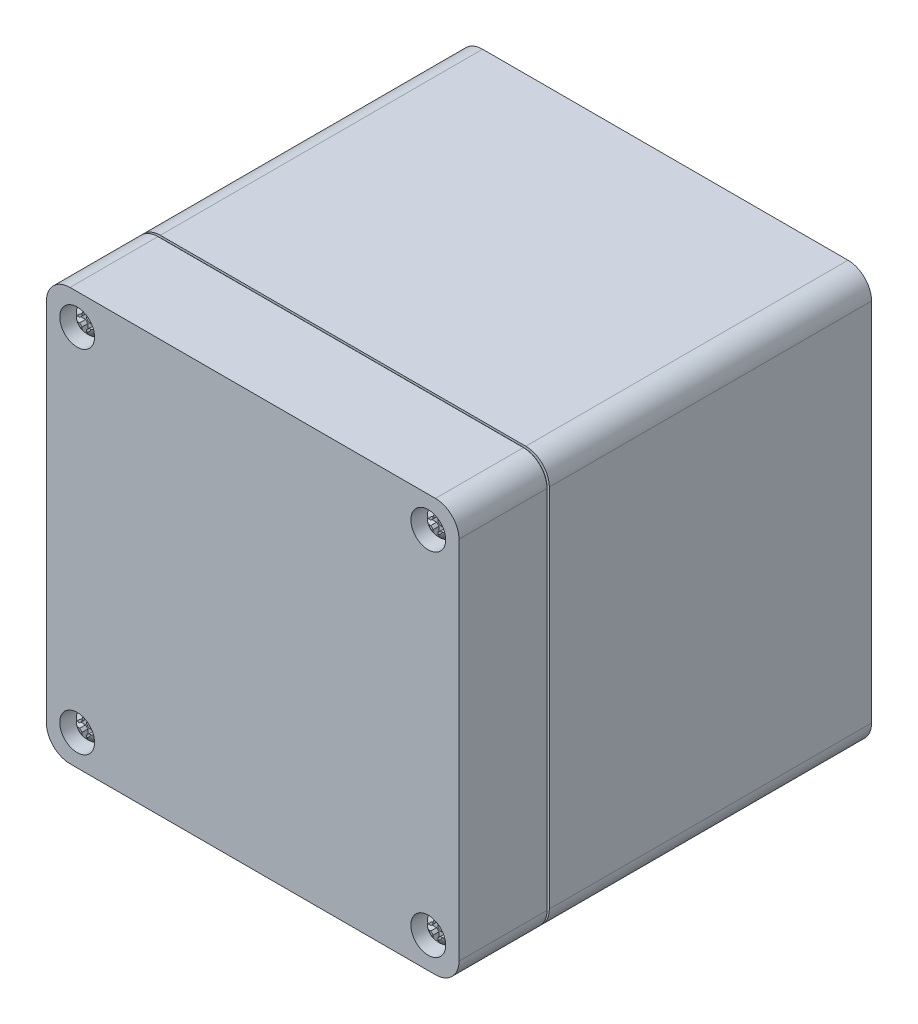
from build123d import *
from OCP.BRepFilletAPI import BRepFilletAPI_MakeChamfer

# Parameters (mm, degrees)
SKETCH3_W                     = 88.9
SKETCH3_H                     = 88.9
BOSS_EXTRUDE1_DEPTH           = 73.8886
CUT_EXTRUDE1_DEPTH            = 70.88886
FILLET1_R                     = 6.35
FILLET2_R                     = 2.54
SKETCH5_W                     = 88.9
SKETCH5_H                     = 88.9
CUT_EXTRUDE2_DEPTH            = 3.45186
SKETCH6_R                     = 2.804922
CUT_EXTRUDE3_DEPTH            = 95.408364787
CUT_EXTRUDE3_DRAFT            = 0.5
CUT_EXTRUDE3_PROFILE_2_DEPTH  = 95.408364787
CUT_EXTRUDE3_PROFILE_2_DRAFT  = 0.5
CUT_EXTRUDE3_PROFILE_3_DEPTH  = 95.408364787
CUT_EXTRUDE3_PROFILE_3_DRAFT  = 0.5
CUT_EXTRUDE3_PROFILE_4_DEPTH  = 95.408364787
CUT_EXTRUDE3_PROFILE_4_DRAFT  = 0.5
SKETCH9_R                     = 4.24942
CUT_EXTRUDE5_DEPTH            = 62.43574
CUT_EXTRUDE5_DRAFT            = -0.5
CUT_EXTRUDE5_PROFILE_2_DEPTH  = 62.43574
CUT_EXTRUDE5_PROFILE_2_DRAFT  = -0.5
CUT_EXTRUDE5_PROFILE_3_DEPTH  = 62.43574
CUT_EXTRUDE5_PROFILE_3_DRAFT  = -0.5
CUT_EXTRUDE5_PROFILE_4_DEPTH  = 62.43574
CUT_EXTRUDE5_PROFILE_4_DRAFT  = -0.5
SKETCH11_R                    = 1.6256
CUT_EXTRUDE6_DEPTH            = 95.408364787
CUT_EXTRUDE7_DEPTH            = 1.27
CHAMFER1_SIZE                 = 0.508
FILLET5_R                     = 1.016
LPATTERN1_COUNT               = 2
LPATTERN1_PITCH               = 75.65644
LPATTERN1_2_COUNT             = 2
LPATTERN1_2_PITCH             = 75.65644
CUT_EXTRUDE8_DEPTH            = 67.437
SKETCH15_R                    = 1.5875
CUT_EXTRUDE9_DEPTH            = 106.190107314
MIRROR2_COPY_1_DEPTH          = 67.437
MIRROR2_COPY_2_SKETCH_R       = 1.5875
MIRROR2_COPY_2_DEPTH          = 106.190107314
SKETCH16_W                    = 88.9
SKETCH16_H                    = 88.9
SKETCH16_W_2                  = 87.95004
SKETCH16_H_2                  = 87.95004
CUT_EXTRUDE11_DEPTH           = 1.00076
FILLET3_R                     = 5.08
BOSS_EXTRUDE2_DEPTH           = 19.46402
CUT_EXTRUDE12_DEPTH           = 98.010979842
CUT_EXTRUDE12_DEPTH_BACK      = 98.010979842
SKETCH18_R                    = 1.75006
SKETCH19_R                    = 3.75031
CUT_EXTRUDE13_DEPTH           = 4.74726
SKETCH20_R                    = 3.24739
CUT_EXTRUDE14_DEPTH           = 13.70076
CUT_EXTRUDE14_DRAFT           = -1
CUT_EXTRUDE14_PROFILE_2_DEPTH = 13.70076
CUT_EXTRUDE14_PROFILE_2_DRAFT = -1
CUT_EXTRUDE14_PROFILE_3_DEPTH = 13.70076
CUT_EXTRUDE14_PROFILE_3_DRAFT = -1
CUT_EXTRUDE14_PROFILE_4_DEPTH = 13.70076
CUT_EXTRUDE14_PROFILE_4_DRAFT = -1
CUT_EXTRUDE15_DEPTH           = 16.46428
CUT_EXTRUDE17_DEPTH           = 0.508
CUT_EXTRUDE18_DEPTH           = 15.95628
FILLET4_R                     = 0.508
CHAMFER2_SIZE                 = 3.048
CHAMFER2_SIZE2                = 0.106438505
CHAMFER3_SIZE                 = 3.048
CHAMFER3_SIZE2                = 0.106438505
SKETCH44_R                    = 7
CUT_EXTRUDE24_DEPTH           = 2.99974
SKETCH45_R                    = 2.25
CUT_EXTRUDE26_DEPTH           = 2.99974
CHAMFER4_SIZE                 = 2.3


with BuildPart() as part:
    # Sketch3 → Boss-Extrude1 (new body)
    with BuildSketch(Plane.XY):
        Rectangle(SKETCH3_W, SKETCH3_H)
    extrude(amount=-BOSS_EXTRUDE1_DEPTH)

    # Sketch4 → Cut-Extrude1 (cut)
    with BuildSketch(Plane.XY):
        Polygon((-41.45026, 21.95068), (-31.75, 21.95068), (-31.75, 41.45026), (31.75, 41.45026), (31.75, 21.95068), (41.45026, 21.95068), (41.45026, -21.95068), (31.75, -21.95068), (31.75, -41.45026), (-31.75, -41.45026), (-31.75, -21.95068), (-41.45026, -21.95068), align=None)
    extrude(amount=-CUT_EXTRUDE1_DEPTH, mode=Mode.SUBTRACT)

    # Fillet1
    fillet1_edges = [part.edges().sort_by_distance(p)[0] for p in [
        (-31.75, 21.95068, -35.44443),
        (31.75, 21.95068, -35.44443),
        (31.75, -21.95068, -35.44443),
        (-31.75, -21.95068, -35.44443),
    ]]
    fillet(fillet1_edges, radius=FILLET1_R)

    # Fillet2
    fillet2_edges = [part.edges().sort_by_distance(p)[0] for p in [
        (-41.45026, -21.95068, -35.44443),
        (-41.45026, 21.95068, -35.44443),
        (-31.75, 41.45026, -35.44443),
        (31.75, 41.45026, -35.44443),
        (41.45026, 21.95068, -35.44443),
        (41.45026, -21.95068, -35.44443),
        (31.75, -41.45026, -35.44443),
        (-31.75, -41.45026, -35.44443),
        (-41.45026, 0, -70.88886),
        (-39.77513, 21.95068, -70.88886),
        (0, 41.45026, -70.88886),
        (31.75, 34.87547, -70.88886),
        (41.45026, 0, -70.88886),
        (39.77513, -21.95068, -70.88886),
        (0, -41.45026, -70.88886),
        (-31.75, -34.87547, -70.88886),
        (39.77513, 21.95068, -70.88886),
        (31.75, -34.87547, -70.88886),
        (-39.77513, -21.95068, -70.88886),
        (-31.75, 34.87547, -70.88886),
        (33.609871939, 23.810551939, -70.88886),
        (33.609871939, -23.810551939, -70.88886),
        (-33.609871939, -23.810551939, -70.88886),
        (-33.609871939, 23.810551939, -70.88886),
    ]]
    fillet(fillet2_edges, radius=FILLET2_R)

    # Sketch5 → Cut-Extrude2 (cut)
    with BuildSketch(Plane.XY):
        Rectangle(SKETCH5_W, SKETCH5_H)
        with BuildLine():
            Line((33.24987, 28.30068), (33.24987, 38.91026))
            ThreePointArc((33.24987, 38.91026), (32.066619472, 41.766879472), (29.21, 42.95013))
            Line((29.21, 42.95013), (-29.21, 42.95013))
            ThreePointArc((-29.21, 42.95013), (-32.066619472, 41.766879472), (-33.24987, 38.91026))
            Line((-33.24987, 38.91026), (-33.24987, 28.30068))
            ThreePointArc((-33.24987, 28.30068), (-34.670440187, 24.871120187), (-38.1, 23.45055))
            Line((-38.1, 23.45055), (-38.91026, 23.45055))
            ThreePointArc((-38.91026, 23.45055), (-41.766879472, 22.267299472), (-42.95013, 19.41068))
            Line((-42.95013, 19.41068), (-42.95013, -19.41068))
            ThreePointArc((-42.95013, -19.41068), (-41.766879472, -22.267299472), (-38.91026, -23.45055))
            Line((-38.91026, -23.45055), (-38.1, -23.45055))
            ThreePointArc((-38.1, -23.45055), (-34.670440187, -24.871120187), (-33.24987, -28.30068))
            Line((-33.24987, -28.30068), (-33.24987, -38.91026))
            ThreePointArc((-33.24987, -38.91026), (-32.066619472, -41.766879472), (-29.21, -42.95013))
            Line((-29.21, -42.95013), (29.21, -42.95013))
            ThreePointArc((29.21, -42.95013), (32.066619472, -41.766879472), (33.24987, -38.91026))
            Line((33.24987, -38.91026), (33.24987, -28.30068))
            ThreePointArc((33.24987, -28.30068), (34.670440187, -24.871120187), (38.1, -23.45055))
            Line((38.1, -23.45055), (38.91026, -23.45055))
            ThreePointArc((38.91026, -23.45055), (41.766879472, -22.267299472), (42.95013, -19.41068))
            Line((42.95013, -19.41068), (42.95013, 19.41068))
            ThreePointArc((42.95013, 19.41068), (41.766879472, 22.267299472), (38.91026, 23.45055))
            Line((38.91026, 23.45055), (38.1, 23.45055))
            ThreePointArc((38.1, 23.45055), (34.670440187, 24.871120187), (33.24987, 28.30068))
        make_face(mode=Mode.SUBTRACT)
    extrude(amount=-CUT_EXTRUDE2_DEPTH, mode=Mode.SUBTRACT)


with BuildPart() as cut_extrude3_tool:
    # Sketch6 → Cut-Extrude3 (with draft: the straight prism first)
    with BuildSketch(Plane.XY.offset(-3.45186)):
        with Locations((37.82822, 37.82822)):
            Circle(SKETCH6_R)
    extrude(amount=-CUT_EXTRUDE3_DEPTH)
    # Cut-Extrude3: the draft: its side faces are tilted about the plane it starts from
    cut_extrude3_sides = [cut_extrude3_tool.faces().sort_by_distance(p)[0] for p in [
        (35.023298, 37.82822, -51.156042394),
    ]]
    draft(cut_extrude3_sides, Plane.XY.offset(-3.45186), CUT_EXTRUDE3_DRAFT)


with BuildPart() as part_1:
    add(part.part)

    # Cut-Extrude3: cut by cut_extrude3_tool
    add(cut_extrude3_tool.part, mode=Mode.SUBTRACT)


with BuildPart() as cut_extrude3_profile_2_tool:
    # Sketch6 → Cut-Extrude3 profile 2 (with draft: the straight prism first)
    with BuildSketch(Plane.XY.offset(-3.45186)):
        with Locations((-37.82822, 37.82822)):
            Circle(SKETCH6_R)
    extrude(amount=-CUT_EXTRUDE3_PROFILE_2_DEPTH)
    # Cut-Extrude3 profile 2: the draft: its side faces are tilted about the plane it starts from
    cut_extrude3_profile_2_sides = [cut_extrude3_profile_2_tool.faces().sort_by_distance(p)[0] for p in [
        (-40.633142, 37.82822, -51.156042394),
    ]]
    draft(cut_extrude3_profile_2_sides, Plane.XY.offset(-3.45186), CUT_EXTRUDE3_PROFILE_2_DRAFT)


with BuildPart() as part_2:
    add(part_1.part)

    # Cut-Extrude3 profile 2: cut by cut_extrude3_profile_2_tool
    add(cut_extrude3_profile_2_tool.part, mode=Mode.SUBTRACT)


with BuildPart() as cut_extrude3_profile_3_tool:
    # Sketch6 → Cut-Extrude3 profile 3 (with draft: the straight prism first)
    with BuildSketch(Plane.XY.offset(-3.45186)):
        with Locations((-37.82822, -37.82822)):
            Circle(SKETCH6_R)
    extrude(amount=-CUT_EXTRUDE3_PROFILE_3_DEPTH)
    # Cut-Extrude3 profile 3: the draft: its side faces are tilted about the plane it starts from
    cut_extrude3_profile_3_sides = [cut_extrude3_profile_3_tool.faces().sort_by_distance(p)[0] for p in [
        (-40.633142, -37.82822, -51.156042394),
    ]]
    draft(cut_extrude3_profile_3_sides, Plane.XY.offset(-3.45186), CUT_EXTRUDE3_PROFILE_3_DRAFT)


with BuildPart() as part_3:
    add(part_2.part)

    # Cut-Extrude3 profile 3: cut by cut_extrude3_profile_3_tool
    add(cut_extrude3_profile_3_tool.part, mode=Mode.SUBTRACT)


with BuildPart() as cut_extrude3_profile_4_tool:
    # Sketch6 → Cut-Extrude3 profile 4 (with draft: the straight prism first)
    with BuildSketch(Plane.XY.offset(-3.45186)):
        with Locations((37.82822, -37.82822)):
            Circle(SKETCH6_R)
    extrude(amount=-CUT_EXTRUDE3_PROFILE_4_DEPTH)
    # Cut-Extrude3 profile 4: the draft: its side faces are tilted about the plane it starts from
    cut_extrude3_profile_4_sides = [cut_extrude3_profile_4_tool.faces().sort_by_distance(p)[0] for p in [
        (35.023298, -37.82822, -51.156042394),
    ]]
    draft(cut_extrude3_profile_4_sides, Plane.XY.offset(-3.45186), CUT_EXTRUDE3_PROFILE_4_DRAFT)


with BuildPart() as part_4:
    add(part_3.part)

    # Cut-Extrude3 profile 4: cut by cut_extrude3_profile_4_tool
    add(cut_extrude3_profile_4_tool.part, mode=Mode.SUBTRACT)


with BuildPart() as cut_extrude5_tool:
    # Sketch9 → Cut-Extrude5 (with draft: the straight prism first)
    with BuildSketch(Plane(origin=(0, 0, -73.8886), x_dir=(-1, 0, 0), z_dir=(0, 0, -1))):
        with Locations((-37.82822, 37.82822)):
            Circle(SKETCH9_R)
    extrude(amount=-CUT_EXTRUDE5_DEPTH)
    # Cut-Extrude5: the draft: its side faces are tilted about the plane it starts from
    cut_extrude5_sides = [cut_extrude5_tool.faces().sort_by_distance(p)[0] for p in [
        (42.07764, 37.82822, -42.67073),
    ]]
    draft(cut_extrude5_sides, Plane(origin=(0, 0, -73.8886), x_dir=(-1, 0, 0), z_dir=(0, 0, -1)), CUT_EXTRUDE5_DRAFT)


with BuildPart() as part_5:
    add(part_4.part)

    # Cut-Extrude5: cut by cut_extrude5_tool
    add(cut_extrude5_tool.part, mode=Mode.SUBTRACT)


with BuildPart() as cut_extrude5_profile_2_tool:
    # Sketch9 → Cut-Extrude5 profile 2 (with draft: the straight prism first)
    with BuildSketch(Plane(origin=(0, 0, -73.8886), x_dir=(-1, 0, 0), z_dir=(0, 0, -1))):
        with Locations((37.82822, 37.82822)):
            Circle(SKETCH9_R)
    extrude(amount=-CUT_EXTRUDE5_PROFILE_2_DEPTH)
    # Cut-Extrude5 profile 2: the draft: its side faces are tilted about the plane it starts from
    cut_extrude5_profile_2_sides = [cut_extrude5_profile_2_tool.faces().sort_by_distance(p)[0] for p in [
        (-33.5788, 37.82822, -42.67073),
    ]]
    draft(cut_extrude5_profile_2_sides, Plane(origin=(0, 0, -73.8886), x_dir=(-1, 0, 0), z_dir=(0, 0, -1)), CUT_EXTRUDE5_PROFILE_2_DRAFT)


with BuildPart() as part_6:
    add(part_5.part)

    # Cut-Extrude5 profile 2: cut by cut_extrude5_profile_2_tool
    add(cut_extrude5_profile_2_tool.part, mode=Mode.SUBTRACT)


with BuildPart() as cut_extrude5_profile_3_tool:
    # Sketch9 → Cut-Extrude5 profile 3 (with draft: the straight prism first)
    with BuildSketch(Plane(origin=(0, 0, -73.8886), x_dir=(-1, 0, 0), z_dir=(0, 0, -1))):
        with Locations((37.82822, -37.82822)):
            Circle(SKETCH9_R)
    extrude(amount=-CUT_EXTRUDE5_PROFILE_3_DEPTH)
    # Cut-Extrude5 profile 3: the draft: its side faces are tilted about the plane it starts from
    cut_extrude5_profile_3_sides = [cut_extrude5_profile_3_tool.faces().sort_by_distance(p)[0] for p in [
        (-33.5788, -37.82822, -42.67073),
    ]]
    draft(cut_extrude5_profile_3_sides, Plane(origin=(0, 0, -73.8886), x_dir=(-1, 0, 0), z_dir=(0, 0, -1)), CUT_EXTRUDE5_PROFILE_3_DRAFT)


with BuildPart() as part_7:
    add(part_6.part)

    # Cut-Extrude5 profile 3: cut by cut_extrude5_profile_3_tool
    add(cut_extrude5_profile_3_tool.part, mode=Mode.SUBTRACT)


with BuildPart() as cut_extrude5_profile_4_tool:
    # Sketch9 → Cut-Extrude5 profile 4 (with draft: the straight prism first)
    with BuildSketch(Plane(origin=(0, 0, -73.8886), x_dir=(-1, 0, 0), z_dir=(0, 0, -1))):
        with Locations((-37.82822, -37.82822)):
            Circle(SKETCH9_R)
    extrude(amount=-CUT_EXTRUDE5_PROFILE_4_DEPTH)
    # Cut-Extrude5 profile 4: the draft: its side faces are tilted about the plane it starts from
    cut_extrude5_profile_4_sides = [cut_extrude5_profile_4_tool.faces().sort_by_distance(p)[0] for p in [
        (42.07764, -37.82822, -42.67073),
    ]]
    draft(cut_extrude5_profile_4_sides, Plane(origin=(0, 0, -73.8886), x_dir=(-1, 0, 0), z_dir=(0, 0, -1)), CUT_EXTRUDE5_PROFILE_4_DRAFT)


with BuildPart() as part_8:
    add(part_7.part)

    # Cut-Extrude5 profile 4: cut by cut_extrude5_profile_4_tool
    add(cut_extrude5_profile_4_tool.part, mode=Mode.SUBTRACT)

    # Sketch14 → Cut-Extrude8 (cut)
    with BuildSketch(Plane.XY.offset(-3.45186)):
        with BuildLine():
            Line((-41.45026, 33.02), (-34.0233, 33.02))
            ThreePointArc((-34.0233, 33.02), (-33.484484633, 32.796815367), (-33.2613, 32.258))
            Line((-33.2613, 32.258), (-33.2613, 29.21))
            ThreePointArc((-33.2613, 29.21), (-34.749197552, 25.617897552), (-38.3413, 24.13))
            Line((-38.3413, 24.13), (-41.45026, 24.13))
            Line((-41.45026, 24.13), (-41.45026, 33.02))
        make_face()
    cut_extrude8 = extrude(amount=-CUT_EXTRUDE8_DEPTH, mode=Mode.SUBTRACT)

    # Sketch15 → Cut-Extrude9 (cut, through all)
    with BuildSketch(Plane.XY.offset(-70.88886)):
        with Locations((-38.1, 28.30068)):
            Circle(SKETCH15_R)
    cut_extrude9 = extrude(amount=-CUT_EXTRUDE9_DEPTH, mode=Mode.SUBTRACT)

    # Mirror1: Cut-Extrude8, Cut-Extrude9 across plane
    add(cut_extrude8.mirror(Plane(origin=(0, 0, 0), x_dir=(0, 0, 1), z_dir=(1, 0, 0))), mode=Mode.SUBTRACT)
    add(cut_extrude9.mirror(Plane(origin=(0, 0, 0), x_dir=(0, 0, 1), z_dir=(1, 0, 0))), mode=Mode.SUBTRACT)

    # Mirror2: Cut-Extrude8, Cut-Extrude9 across plane
    add(cut_extrude8.mirror(Plane.ZX), mode=Mode.SUBTRACT)
    add(cut_extrude9.mirror(Plane.ZX), mode=Mode.SUBTRACT)

    # Mirror2 copy 1 sketch → Mirror2 copy 1 (cut)
    with BuildSketch(Plane(origin=(0, 0, -3.45186), x_dir=(-1, 0, 0), z_dir=(0, 0, 1))):
        with BuildLine():
            Line((-41.45026, 33.02), (-34.0233, 33.02))
            ThreePointArc((-34.0233, 33.02), (-33.484484633, 32.796815367), (-33.2613, 32.258))
            Line((-33.2613, 32.258), (-33.2613, 29.21))
            ThreePointArc((-33.2613, 29.21), (-34.749197552, 25.617897552), (-38.3413, 24.13))
            Line((-38.3413, 24.13), (-41.45026, 24.13))
            Line((-41.45026, 24.13), (-41.45026, 33.02))
        make_face()
    extrude(amount=-MIRROR2_COPY_1_DEPTH, mode=Mode.SUBTRACT)

    # Mirror2 copy 2 sketch → Mirror2 copy 2 (cut, through all)
    with BuildSketch(Plane(origin=(0, 0, -70.88886), x_dir=(-1, 0, 0), z_dir=(0, 0, 1))):
        with Locations((-38.1, 28.30068)):
            Circle(MIRROR2_COPY_2_SKETCH_R)
    extrude(amount=-MIRROR2_COPY_2_DEPTH, mode=Mode.SUBTRACT)

    # Sketch16 → Cut-Extrude11 (cut)
    with BuildSketch(Plane.XY.offset(-3.45186)):
        Rectangle(SKETCH16_W, SKETCH16_H)
        Rectangle(SKETCH16_W_2, SKETCH16_H_2, mode=Mode.SUBTRACT)
    extrude(amount=-CUT_EXTRUDE11_DEPTH, mode=Mode.SUBTRACT)

    # Fillet3
    fillet3_edges = [part_8.edges().sort_by_distance(p)[0] for p in [
        (43.97502, -43.97502, -3.95224),
        (-43.97502, -43.97502, -3.95224),
        (-43.97502, 43.97502, -3.95224),
        (43.97502, 43.97502, -3.95224),
        (-44.45, 44.45, -39.17061),
        (44.45, 44.45, -39.17061),
        (44.45, -44.45, -39.17061),
        (-44.45, -44.45, -39.17061),
    ]]
    fillet(fillet3_edges, radius=FILLET3_R)

    # Chamfer2: one chamfer whose edges measure the first distance from different faces: ONE call of the kernel's chamfer builder (chamfer() names one face for all edges)
    chamfer2_edges_1 = [part_8.edges().sort_by_distance(p)[0] for p in [
        (34.670440187, 24.871120187, 0),
    ]]
    chamfer2_side_1 = [part_8.faces().sort_by_distance(p)[0] for p in [
        (34.670440187, 24.871120187, -1.72593),
    ]]
    chamfer2_edges_2 = [part_8.edges().sort_by_distance(p)[0] for p in [
        (38.50513, 23.45055, 0),
    ]]
    chamfer2_side_2 = [part_8.faces().sort_by_distance(p)[0] for p in [
        (38.50513, 23.45055, -1.72593),
    ]]
    chamfer2_edges_3 = [part_8.edges().sort_by_distance(p)[0] for p in [
        (41.766879472, 22.267299472, 0),
    ]]
    chamfer2_side_3 = [part_8.faces().sort_by_distance(p)[0] for p in [
        (41.766879472, 22.267299472, -1.72593),
    ]]
    chamfer2_edges_4 = [part_8.edges().sort_by_distance(p)[0] for p in [
        (42.95013, 0, 0),
    ]]
    chamfer2_side_4 = [part_8.faces().sort_by_distance(p)[0] for p in [
        (42.95013, 0, -1.72593),
    ]]
    chamfer2_edges_5 = [part_8.edges().sort_by_distance(p)[0] for p in [
        (41.766879472, -22.267299472, 0),
    ]]
    chamfer2_side_5 = [part_8.faces().sort_by_distance(p)[0] for p in [
        (41.766879472, -22.267299472, -1.72593),
    ]]
    chamfer2_edges_6 = [part_8.edges().sort_by_distance(p)[0] for p in [
        (38.50513, -23.45055, 0),
    ]]
    chamfer2_side_6 = [part_8.faces().sort_by_distance(p)[0] for p in [
        (38.50513, -23.45055, -1.72593),
    ]]
    chamfer2_edges_7 = [part_8.edges().sort_by_distance(p)[0] for p in [
        (34.670440187, -24.871120187, 0),
    ]]
    chamfer2_side_7 = [part_8.faces().sort_by_distance(p)[0] for p in [
        (34.670440187, -24.871120187, -1.72593),
    ]]
    chamfer2_edges_8 = [part_8.edges().sort_by_distance(p)[0] for p in [
        (33.24987, -33.60547, 0),
    ]]
    chamfer2_side_8 = [part_8.faces().sort_by_distance(p)[0] for p in [
        (33.24987, -33.60547, -1.72593),
    ]]
    chamfer2_edges_9 = [part_8.edges().sort_by_distance(p)[0] for p in [
        (32.066619472, -41.766879472, 0),
    ]]
    chamfer2_side_9 = [part_8.faces().sort_by_distance(p)[0] for p in [
        (32.066619472, -41.766879472, -1.72593),
    ]]
    chamfer2_edges_10 = [part_8.edges().sort_by_distance(p)[0] for p in [
        (0, -42.95013, 0),
    ]]
    chamfer2_side_10 = [part_8.faces().sort_by_distance(p)[0] for p in [
        (0, -42.95013, -1.72593),
    ]]
    chamfer2_edges_11 = [part_8.edges().sort_by_distance(p)[0] for p in [
        (-32.066619472, -41.766879472, 0),
    ]]
    chamfer2_side_11 = [part_8.faces().sort_by_distance(p)[0] for p in [
        (-32.066619472, -41.766879472, -1.72593),
    ]]
    chamfer2_edges_12 = [part_8.edges().sort_by_distance(p)[0] for p in [
        (-33.24987, -33.60547, 0),
    ]]
    chamfer2_side_12 = [part_8.faces().sort_by_distance(p)[0] for p in [
        (-33.24987, -33.60547, -1.72593),
    ]]
    chamfer2_edges_13 = [part_8.edges().sort_by_distance(p)[0] for p in [
        (-34.670440187, -24.871120187, 0),
    ]]
    chamfer2_side_13 = [part_8.faces().sort_by_distance(p)[0] for p in [
        (-34.670440187, -24.871120187, -1.72593),
    ]]
    chamfer2_edges_14 = [part_8.edges().sort_by_distance(p)[0] for p in [
        (-38.50513, -23.45055, 0),
    ]]
    chamfer2_side_14 = [part_8.faces().sort_by_distance(p)[0] for p in [
        (-38.50513, -23.45055, -1.72593),
    ]]
    chamfer2_edges_15 = [part_8.edges().sort_by_distance(p)[0] for p in [
        (-41.766879472, -22.267299472, 0),
    ]]
    chamfer2_side_15 = [part_8.faces().sort_by_distance(p)[0] for p in [
        (-41.766879472, -22.267299472, -1.72593),
    ]]
    chamfer2_edges_16 = [part_8.edges().sort_by_distance(p)[0] for p in [
        (-42.95013, 0, 0),
    ]]
    chamfer2_side_16 = [part_8.faces().sort_by_distance(p)[0] for p in [
        (-42.95013, 0, -1.72593),
    ]]
    chamfer2_edges_17 = [part_8.edges().sort_by_distance(p)[0] for p in [
        (-41.766879472, 22.267299472, 0),
    ]]
    chamfer2_side_17 = [part_8.faces().sort_by_distance(p)[0] for p in [
        (-41.766879472, 22.267299472, -1.72593),
    ]]
    chamfer2_edges_18 = [part_8.edges().sort_by_distance(p)[0] for p in [
        (-38.50513, 23.45055, 0),
    ]]
    chamfer2_side_18 = [part_8.faces().sort_by_distance(p)[0] for p in [
        (-38.50513, 23.45055, -1.72593),
    ]]
    chamfer2_edges_19 = [part_8.edges().sort_by_distance(p)[0] for p in [
        (-34.670440187, 24.871120187, 0),
    ]]
    chamfer2_side_19 = [part_8.faces().sort_by_distance(p)[0] for p in [
        (-34.670440187, 24.871120187, -1.72593),
    ]]
    chamfer2_edges_20 = [part_8.edges().sort_by_distance(p)[0] for p in [
        (-33.24987, 33.60547, 0),
    ]]
    chamfer2_side_20 = [part_8.faces().sort_by_distance(p)[0] for p in [
        (-33.24987, 33.60547, -1.72593),
    ]]
    chamfer2_edges_21 = [part_8.edges().sort_by_distance(p)[0] for p in [
        (-32.066619472, 41.766879472, 0),
    ]]
    chamfer2_side_21 = [part_8.faces().sort_by_distance(p)[0] for p in [
        (-32.066619472, 41.766879472, -1.72593),
    ]]
    chamfer2_edges_22 = [part_8.edges().sort_by_distance(p)[0] for p in [
        (0, 42.95013, 0),
    ]]
    chamfer2_side_22 = [part_8.faces().sort_by_distance(p)[0] for p in [
        (0, 42.95013, -1.72593),
    ]]
    chamfer2_edges_23 = [part_8.edges().sort_by_distance(p)[0] for p in [
        (32.066619472, 41.766879472, 0),
    ]]
    chamfer2_side_23 = [part_8.faces().sort_by_distance(p)[0] for p in [
        (32.066619472, 41.766879472, -1.72593),
    ]]
    chamfer2_edges_24 = [part_8.edges().sort_by_distance(p)[0] for p in [
        (33.24987, 33.60547, 0),
    ]]
    chamfer2_side_24 = [part_8.faces().sort_by_distance(p)[0] for p in [
        (33.24987, 33.60547, -1.72593),
    ]]
    chamfer2 = BRepFilletAPI_MakeChamfer(part_8.part.solid().wrapped)
    for e in chamfer2_edges_1:
        chamfer2.Add(CHAMFER2_SIZE, CHAMFER2_SIZE2, e.wrapped, chamfer2_side_1[0].wrapped)  # the first distance lies on this face
    for e in chamfer2_edges_2:
        chamfer2.Add(CHAMFER2_SIZE, CHAMFER2_SIZE2, e.wrapped, chamfer2_side_2[0].wrapped)  # the first distance lies on this face
    for e in chamfer2_edges_3:
        chamfer2.Add(CHAMFER2_SIZE, CHAMFER2_SIZE2, e.wrapped, chamfer2_side_3[0].wrapped)  # the first distance lies on this face
    for e in chamfer2_edges_4:
        chamfer2.Add(CHAMFER2_SIZE, CHAMFER2_SIZE2, e.wrapped, chamfer2_side_4[0].wrapped)  # the first distance lies on this face
    for e in chamfer2_edges_5:
        chamfer2.Add(CHAMFER2_SIZE, CHAMFER2_SIZE2, e.wrapped, chamfer2_side_5[0].wrapped)  # the first distance lies on this face
    for e in chamfer2_edges_6:
        chamfer2.Add(CHAMFER2_SIZE, CHAMFER2_SIZE2, e.wrapped, chamfer2_side_6[0].wrapped)  # the first distance lies on this face
    for e in chamfer2_edges_7:
        chamfer2.Add(CHAMFER2_SIZE, CHAMFER2_SIZE2, e.wrapped, chamfer2_side_7[0].wrapped)  # the first distance lies on this face
    for e in chamfer2_edges_8:
        chamfer2.Add(CHAMFER2_SIZE, CHAMFER2_SIZE2, e.wrapped, chamfer2_side_8[0].wrapped)  # the first distance lies on this face
    for e in chamfer2_edges_9:
        chamfer2.Add(CHAMFER2_SIZE, CHAMFER2_SIZE2, e.wrapped, chamfer2_side_9[0].wrapped)  # the first distance lies on this face
    for e in chamfer2_edges_10:
        chamfer2.Add(CHAMFER2_SIZE, CHAMFER2_SIZE2, e.wrapped, chamfer2_side_10[0].wrapped)  # the first distance lies on this face
    for e in chamfer2_edges_11:
        chamfer2.Add(CHAMFER2_SIZE, CHAMFER2_SIZE2, e.wrapped, chamfer2_side_11[0].wrapped)  # the first distance lies on this face
    for e in chamfer2_edges_12:
        chamfer2.Add(CHAMFER2_SIZE, CHAMFER2_SIZE2, e.wrapped, chamfer2_side_12[0].wrapped)  # the first distance lies on this face
    for e in chamfer2_edges_13:
        chamfer2.Add(CHAMFER2_SIZE, CHAMFER2_SIZE2, e.wrapped, chamfer2_side_13[0].wrapped)  # the first distance lies on this face
    for e in chamfer2_edges_14:
        chamfer2.Add(CHAMFER2_SIZE, CHAMFER2_SIZE2, e.wrapped, chamfer2_side_14[0].wrapped)  # the first distance lies on this face
    for e in chamfer2_edges_15:
        chamfer2.Add(CHAMFER2_SIZE, CHAMFER2_SIZE2, e.wrapped, chamfer2_side_15[0].wrapped)  # the first distance lies on this face
    for e in chamfer2_edges_16:
        chamfer2.Add(CHAMFER2_SIZE, CHAMFER2_SIZE2, e.wrapped, chamfer2_side_16[0].wrapped)  # the first distance lies on this face
    for e in chamfer2_edges_17:
        chamfer2.Add(CHAMFER2_SIZE, CHAMFER2_SIZE2, e.wrapped, chamfer2_side_17[0].wrapped)  # the first distance lies on this face
    for e in chamfer2_edges_18:
        chamfer2.Add(CHAMFER2_SIZE, CHAMFER2_SIZE2, e.wrapped, chamfer2_side_18[0].wrapped)  # the first distance lies on this face
    for e in chamfer2_edges_19:
        chamfer2.Add(CHAMFER2_SIZE, CHAMFER2_SIZE2, e.wrapped, chamfer2_side_19[0].wrapped)  # the first distance lies on this face
    for e in chamfer2_edges_20:
        chamfer2.Add(CHAMFER2_SIZE, CHAMFER2_SIZE2, e.wrapped, chamfer2_side_20[0].wrapped)  # the first distance lies on this face
    for e in chamfer2_edges_21:
        chamfer2.Add(CHAMFER2_SIZE, CHAMFER2_SIZE2, e.wrapped, chamfer2_side_21[0].wrapped)  # the first distance lies on this face
    for e in chamfer2_edges_22:
        chamfer2.Add(CHAMFER2_SIZE, CHAMFER2_SIZE2, e.wrapped, chamfer2_side_22[0].wrapped)  # the first distance lies on this face
    for e in chamfer2_edges_23:
        chamfer2.Add(CHAMFER2_SIZE, CHAMFER2_SIZE2, e.wrapped, chamfer2_side_23[0].wrapped)  # the first distance lies on this face
    for e in chamfer2_edges_24:
        chamfer2.Add(CHAMFER2_SIZE, CHAMFER2_SIZE2, e.wrapped, chamfer2_side_24[0].wrapped)  # the first distance lies on this face
    add(Compound.cast(chamfer2.Shape()), mode=Mode.REPLACE)

    # Chamfer3: one chamfer whose edges measure the first distance from different faces: ONE call of the kernel's chamfer builder (chamfer() names one face for all edges)
    chamfer3_edges_1 = [part_8.edges().sort_by_distance(p)[0] for p in [
        (31.006051224, -40.706311224, 0),
    ]]
    chamfer3_side_1 = [part_8.faces().sort_by_distance(p)[0] for p in [
        (31.006051224, -40.706311224, -34.17443),
    ]]
    chamfer3_edges_2 = [part_8.edges().sort_by_distance(p)[0] for p in [
        (-31.006051224, -40.706311224, 0),
    ]]
    chamfer3_side_2 = [part_8.faces().sort_by_distance(p)[0] for p in [
        (-31.006051224, -40.706311224, -34.17443),
    ]]
    chamfer3_edges_3 = [part_8.edges().sort_by_distance(p)[0] for p in [
        (-40.706311224, -21.206731224, 0),
    ]]
    chamfer3_side_3 = [part_8.faces().sort_by_distance(p)[0] for p in [
        (-40.706311224, -21.206731224, -34.17443),
    ]]
    chamfer3_edges_4 = [part_8.edges().sort_by_distance(p)[0] for p in [
        (-40.706311224, 21.206731224, 0),
    ]]
    chamfer3_side_4 = [part_8.faces().sort_by_distance(p)[0] for p in [
        (-40.706311224, 21.206731224, -34.17443),
    ]]
    chamfer3_edges_5 = [part_8.edges().sort_by_distance(p)[0] for p in [
        (-31.006051224, 40.706311224, 0),
    ]]
    chamfer3_side_5 = [part_8.faces().sort_by_distance(p)[0] for p in [
        (-31.006051224, 40.706311224, -34.17443),
    ]]
    chamfer3_edges_6 = [part_8.edges().sort_by_distance(p)[0] for p in [
        (31.006051224, 40.706311224, 0),
    ]]
    chamfer3_side_6 = [part_8.faces().sort_by_distance(p)[0] for p in [
        (31.006051224, 40.706311224, -34.17443),
    ]]
    chamfer3_edges_7 = [part_8.edges().sort_by_distance(p)[0] for p in [
        (40.706311224, 21.206731224, 0),
    ]]
    chamfer3_side_7 = [part_8.faces().sort_by_distance(p)[0] for p in [
        (40.706311224, 21.206731224, -34.17443),
    ]]
    chamfer3_edges_8 = [part_8.edges().sort_by_distance(p)[0] for p in [
        (40.706311224, -21.206731224, 0),
    ]]
    chamfer3_side_8 = [part_8.faces().sort_by_distance(p)[0] for p in [
        (40.706311224, -21.206731224, -34.17443),
    ]]
    chamfer3_edges_9 = [part_8.edges().sort_by_distance(p)[0] for p in [
        (31.75, 33.60547, 0),
    ]]
    chamfer3_side_9 = [part_8.faces().sort_by_distance(p)[0] for p in [
        (31.75, 33.60547, -34.17443),
    ]]
    chamfer3_edges_10 = [part_8.edges().sort_by_distance(p)[0] for p in [
        (-38.50513, 21.95068, 0),
    ]]
    chamfer3_side_10 = [part_8.faces().sort_by_distance(p)[0] for p in [
        (-38.50513, 21.95068, -34.17443),
    ]]
    chamfer3_edges_11 = [part_8.edges().sort_by_distance(p)[0] for p in [
        (38.50513, -21.95068, 0),
    ]]
    chamfer3_side_11 = [part_8.faces().sort_by_distance(p)[0] for p in [
        (38.50513, -21.95068, -34.17443),
    ]]
    chamfer3_edges_12 = [part_8.edges().sort_by_distance(p)[0] for p in [
        (-31.75, -33.60547, 0),
    ]]
    chamfer3_side_12 = [part_8.faces().sort_by_distance(p)[0] for p in [
        (-31.75, -33.60547, -34.17443),
    ]]
    chamfer3_edges_13 = [part_8.edges().sort_by_distance(p)[0] for p in [
        (-33.609871939, 23.810551939, 0),
    ]]
    chamfer3_side_13 = [part_8.faces().sort_by_distance(p)[0] for p in [
        (-33.609871939, 23.810551939, -34.17443),
    ]]
    chamfer3_edges_14 = [part_8.edges().sort_by_distance(p)[0] for p in [
        (-33.609871939, -23.810551939, 0),
    ]]
    chamfer3_side_14 = [part_8.faces().sort_by_distance(p)[0] for p in [
        (-33.609871939, -23.810551939, -34.17443),
    ]]
    chamfer3_edges_15 = [part_8.edges().sort_by_distance(p)[0] for p in [
        (33.609871939, -23.810551939, 0),
    ]]
    chamfer3_side_15 = [part_8.faces().sort_by_distance(p)[0] for p in [
        (33.609871939, -23.810551939, -34.17443),
    ]]
    chamfer3_edges_16 = [part_8.edges().sort_by_distance(p)[0] for p in [
        (33.609871939, 23.810551939, 0),
    ]]
    chamfer3_side_16 = [part_8.faces().sort_by_distance(p)[0] for p in [
        (33.609871939, 23.810551939, -34.17443),
    ]]
    chamfer3_edges_17 = [part_8.edges().sort_by_distance(p)[0] for p in [
        (-31.75, 33.60547, 0),
    ]]
    chamfer3_side_17 = [part_8.faces().sort_by_distance(p)[0] for p in [
        (-31.75, 33.60547, -34.17443),
    ]]
    chamfer3_edges_18 = [part_8.edges().sort_by_distance(p)[0] for p in [
        (0, 41.45026, 0),
    ]]
    chamfer3_side_18 = [part_8.faces().sort_by_distance(p)[0] for p in [
        (0, 41.45026, -34.17443),
    ]]
    chamfer3_edges_19 = [part_8.edges().sort_by_distance(p)[0] for p in [
        (38.50513, 21.95068, 0),
    ]]
    chamfer3_side_19 = [part_8.faces().sort_by_distance(p)[0] for p in [
        (38.50513, 21.95068, -34.17443),
    ]]
    chamfer3_edges_20 = [part_8.edges().sort_by_distance(p)[0] for p in [
        (41.45026, 0, 0),
    ]]
    chamfer3_side_20 = [part_8.faces().sort_by_distance(p)[0] for p in [
        (41.45026, 0, -34.17443),
    ]]
    chamfer3_edges_21 = [part_8.edges().sort_by_distance(p)[0] for p in [
        (31.75, -33.60547, 0),
    ]]
    chamfer3_side_21 = [part_8.faces().sort_by_distance(p)[0] for p in [
        (31.75, -33.60547, -34.17443),
    ]]
    chamfer3_edges_22 = [part_8.edges().sort_by_distance(p)[0] for p in [
        (0, -41.45026, 0),
    ]]
    chamfer3_side_22 = [part_8.faces().sort_by_distance(p)[0] for p in [
        (0, -41.45026, -34.17443),
    ]]
    chamfer3_edges_23 = [part_8.edges().sort_by_distance(p)[0] for p in [
        (-38.50513, -21.95068, 0),
    ]]
    chamfer3_side_23 = [part_8.faces().sort_by_distance(p)[0] for p in [
        (-38.50513, -21.95068, -34.17443),
    ]]
    chamfer3_edges_24 = [part_8.edges().sort_by_distance(p)[0] for p in [
        (-41.45026, 0, 0),
    ]]
    chamfer3_side_24 = [part_8.faces().sort_by_distance(p)[0] for p in [
        (-41.45026, 0, -34.17443),
    ]]
    chamfer3 = BRepFilletAPI_MakeChamfer(part_8.part.solid().wrapped)
    for e in chamfer3_edges_1:
        chamfer3.Add(CHAMFER3_SIZE, CHAMFER3_SIZE2, e.wrapped, chamfer3_side_1[0].wrapped)  # the first distance lies on this face
    for e in chamfer3_edges_2:
        chamfer3.Add(CHAMFER3_SIZE, CHAMFER3_SIZE2, e.wrapped, chamfer3_side_2[0].wrapped)  # the first distance lies on this face
    for e in chamfer3_edges_3:
        chamfer3.Add(CHAMFER3_SIZE, CHAMFER3_SIZE2, e.wrapped, chamfer3_side_3[0].wrapped)  # the first distance lies on this face
    for e in chamfer3_edges_4:
        chamfer3.Add(CHAMFER3_SIZE, CHAMFER3_SIZE2, e.wrapped, chamfer3_side_4[0].wrapped)  # the first distance lies on this face
    for e in chamfer3_edges_5:
        chamfer3.Add(CHAMFER3_SIZE, CHAMFER3_SIZE2, e.wrapped, chamfer3_side_5[0].wrapped)  # the first distance lies on this face
    for e in chamfer3_edges_6:
        chamfer3.Add(CHAMFER3_SIZE, CHAMFER3_SIZE2, e.wrapped, chamfer3_side_6[0].wrapped)  # the first distance lies on this face
    for e in chamfer3_edges_7:
        chamfer3.Add(CHAMFER3_SIZE, CHAMFER3_SIZE2, e.wrapped, chamfer3_side_7[0].wrapped)  # the first distance lies on this face
    for e in chamfer3_edges_8:
        chamfer3.Add(CHAMFER3_SIZE, CHAMFER3_SIZE2, e.wrapped, chamfer3_side_8[0].wrapped)  # the first distance lies on this face
    for e in chamfer3_edges_9:
        chamfer3.Add(CHAMFER3_SIZE, CHAMFER3_SIZE2, e.wrapped, chamfer3_side_9[0].wrapped)  # the first distance lies on this face
    for e in chamfer3_edges_10:
        chamfer3.Add(CHAMFER3_SIZE, CHAMFER3_SIZE2, e.wrapped, chamfer3_side_10[0].wrapped)  # the first distance lies on this face
    for e in chamfer3_edges_11:
        chamfer3.Add(CHAMFER3_SIZE, CHAMFER3_SIZE2, e.wrapped, chamfer3_side_11[0].wrapped)  # the first distance lies on this face
    for e in chamfer3_edges_12:
        chamfer3.Add(CHAMFER3_SIZE, CHAMFER3_SIZE2, e.wrapped, chamfer3_side_12[0].wrapped)  # the first distance lies on this face
    for e in chamfer3_edges_13:
        chamfer3.Add(CHAMFER3_SIZE, CHAMFER3_SIZE2, e.wrapped, chamfer3_side_13[0].wrapped)  # the first distance lies on this face
    for e in chamfer3_edges_14:
        chamfer3.Add(CHAMFER3_SIZE, CHAMFER3_SIZE2, e.wrapped, chamfer3_side_14[0].wrapped)  # the first distance lies on this face
    for e in chamfer3_edges_15:
        chamfer3.Add(CHAMFER3_SIZE, CHAMFER3_SIZE2, e.wrapped, chamfer3_side_15[0].wrapped)  # the first distance lies on this face
    for e in chamfer3_edges_16:
        chamfer3.Add(CHAMFER3_SIZE, CHAMFER3_SIZE2, e.wrapped, chamfer3_side_16[0].wrapped)  # the first distance lies on this face
    for e in chamfer3_edges_17:
        chamfer3.Add(CHAMFER3_SIZE, CHAMFER3_SIZE2, e.wrapped, chamfer3_side_17[0].wrapped)  # the first distance lies on this face
    for e in chamfer3_edges_18:
        chamfer3.Add(CHAMFER3_SIZE, CHAMFER3_SIZE2, e.wrapped, chamfer3_side_18[0].wrapped)  # the first distance lies on this face
    for e in chamfer3_edges_19:
        chamfer3.Add(CHAMFER3_SIZE, CHAMFER3_SIZE2, e.wrapped, chamfer3_side_19[0].wrapped)  # the first distance lies on this face
    for e in chamfer3_edges_20:
        chamfer3.Add(CHAMFER3_SIZE, CHAMFER3_SIZE2, e.wrapped, chamfer3_side_20[0].wrapped)  # the first distance lies on this face
    for e in chamfer3_edges_21:
        chamfer3.Add(CHAMFER3_SIZE, CHAMFER3_SIZE2, e.wrapped, chamfer3_side_21[0].wrapped)  # the first distance lies on this face
    for e in chamfer3_edges_22:
        chamfer3.Add(CHAMFER3_SIZE, CHAMFER3_SIZE2, e.wrapped, chamfer3_side_22[0].wrapped)  # the first distance lies on this face
    for e in chamfer3_edges_23:
        chamfer3.Add(CHAMFER3_SIZE, CHAMFER3_SIZE2, e.wrapped, chamfer3_side_23[0].wrapped)  # the first distance lies on this face
    for e in chamfer3_edges_24:
        chamfer3.Add(CHAMFER3_SIZE, CHAMFER3_SIZE2, e.wrapped, chamfer3_side_24[0].wrapped)  # the first distance lies on this face
    add(Compound.cast(chamfer3.Shape()), mode=Mode.REPLACE)

    # Sketch44 → Cut-Extrude24 (cut)
    with BuildSketch(Plane(origin=(0, -41.45026, 0), x_dir=(1, 0, 0), z_dir=(0, 1, 0))):
        with Locations(Location((-19, 60.88886, 0), (0, 0, 270))):
            Circle(SKETCH44_R)
    extrude(amount=-CUT_EXTRUDE24_DEPTH, mode=Mode.SUBTRACT)

    # Sketch45 → Cut-Extrude26 (cut)
    with BuildSketch(Plane(origin=(0, 0, -73.8886), x_dir=(-1, 0, 0), z_dir=(0, 0, -1))):
        with Locations((21, 21)):
            Circle(SKETCH45_R)
        with Locations((-21, -21)):
            Circle(SKETCH45_R)
    extrude(amount=-CUT_EXTRUDE26_DEPTH, mode=Mode.SUBTRACT)

    # Chamfer4
    chamfer4_edges = [part_8.edges().sort_by_distance(p)[0] for p in [
        (-18.75, 21, -73.8886),
        (23.25, -21, -73.8886),
    ]]
    chamfer(chamfer4_edges, length=CHAMFER4_SIZE)


with BuildPart() as body_2:
    # Sketch10 → Revolve4 (revolve)
    with BuildSketch(Plane(origin=(0, 37.82822, 0), x_dir=(1, 0, 0), z_dir=(0, 1, 0))):
        Polygon((-40.59682, 9.80186), (-40.59682, 8.73506), (-40.74922, 8.02386), (-40.59682, 8.02386), (-40.59682, 7.00786), (-41.00322, 7.00786), (-41.00322, 5.73786), (-40.59682, 5.73786), (-40.59682, 4.72186), (-41.00322, 4.72186), (-41.00322, 3.45186), (-37.82822, 3.45186), (-37.82822, 9.80186), align=None)
    revolve(axis=Axis((-37.82822, 37.82822, -11.131588208), (0, 0, 1)))

    # Sketch11 → Cut-Extrude6 (cut, through all)
    with BuildSketch(Plane.XY.offset(-3.45186)):
        with Locations((-37.82822, 37.82822)):
            Circle(SKETCH11_R)
    extrude(amount=-CUT_EXTRUDE6_DEPTH, mode=Mode.SUBTRACT)


with BuildPart() as body_3:
    # Sketch12 → Revolve5 (revolve)
    with BuildSketch(Plane(origin=(0, 37.82822, 0), x_dir=(1, 0, 0), z_dir=(0, 1, 0))):
        with BuildLine():
            Line((-37.82822, 8.68934), (-37.82822, -13.45184))
            Line((-37.82822, -13.45184), (-39.35222, -13.45184))
            ThreePointArc((-39.35222, -13.45184), (-40.828281784, -12.100020411), (-41.32072, -10.16))
            Line((-41.32072, -10.16), (-39.54272, -10.16))
            Line((-39.54272, -10.16), (-39.54272, 8.68934))
            Line((-39.54272, 8.68934), (-37.82822, 8.68934))
        make_face()
    revolve(axis=Axis((-37.82822, 37.82822, -11.131588208), (0, 0, 1)))

    # Sketch13 → Cut-Extrude7 (cut)
    with BuildSketch(Plane.XY.offset(13.45184)):
        Polygon((-43.90644, 38.33622), (-43.90644, 37.32022), (-38.33622, 37.32022), (-38.33622, 35.28822), (-37.32022, 35.28822), (-37.32022, 37.32022), (-31.75, 37.32022), (-31.75, 38.33622), (-37.32022, 38.33622), (-37.32022, 40.36822), (-38.33622, 40.36822), (-38.33622, 38.33622), align=None)
    extrude(amount=-CUT_EXTRUDE7_DEPTH, mode=Mode.SUBTRACT)

    # Chamfer1
    chamfer1_edges = [body_3.edges().sort_by_distance(p)[0] for p in [
        (-38.33622, 38.33622, 12.81684),
        (-37.32022, 38.33622, 12.81684),
        (-37.32022, 37.32022, 12.81684),
        (-38.33622, 37.32022, 12.81684),
    ]]
    chamfer(chamfer1_edges, length=CHAMFER1_SIZE)

    # Fillet5
    fillet5_edges = [body_3.edges().sort_by_distance(p)[0] for p in [
        (-34.33572, 37.82822, 10.16),
    ]]
    fillet(fillet5_edges, radius=FILLET5_R)


with BuildPart() as lpattern1_1:
    # LPattern1: pattern copy
    add(body_2.part.moved(Location(Vector(1, 0, 0) * (1 * LPATTERN1_PITCH))))


with BuildPart() as lpattern1_2:
    # LPattern1: pattern copy
    add(body_3.part.moved(Location(Vector(1, 0, 0) * (1 * LPATTERN1_PITCH))))


with BuildPart() as lpattern1_2_1:
    # LPattern1 2: pattern copy
    add(body_2.part.moved(Location(Vector(0, -1, 0) * (1 * LPATTERN1_2_PITCH))))


with BuildPart() as lpattern1_2_2:
    # LPattern1 2: pattern copy
    add(body_3.part.moved(Location(Vector(0, -1, 0) * (1 * LPATTERN1_2_PITCH))))


with BuildPart() as lpattern1_2_3:
    # LPattern1 2: pattern copy
    add(lpattern1_1.part.moved(Location(Vector(0, -1, 0) * (1 * LPATTERN1_2_PITCH))))


with BuildPart() as lpattern1_2_4:
    # LPattern1 2: pattern copy
    add(lpattern1_2.part.moved(Location(Vector(0, -1, 0) * (1 * LPATTERN1_2_PITCH))))


with BuildPart() as body_10:
    # Sketch17 → Boss-Extrude2 (new body)
    with BuildSketch(Plane.XY.offset(-4.45262)):
        with BuildLine():
            Line((-39.37, -44.45), (39.37, -44.45))
            ThreePointArc((39.37, -44.45), (42.962102448, -42.962102448), (44.45, -39.37))
            Line((44.45, -39.37), (44.45, 39.37))
            ThreePointArc((44.45, 39.37), (42.962102448, 42.962102448), (39.37, 44.45))
            Line((39.37, 44.45), (-39.37, 44.45))
            ThreePointArc((-39.37, 44.45), (-42.962102448, 42.962102448), (-44.45, 39.37))
            Line((-44.45, 39.37), (-44.45, -39.37))
            ThreePointArc((-44.45, -39.37), (-42.962102448, -42.962102448), (-39.37, -44.45))
        make_face()
    extrude(amount=BOSS_EXTRUDE2_DEPTH)

    # Sketch18 → Cut-Extrude12 (cut, two sides: drawn at the far end of the back side and taken through both)
    with BuildSketch(Plane.XY.offset(-CUT_EXTRUDE12_DEPTH_BACK)):
        with Locations((37.82822, 37.82822)):
            Circle(SKETCH18_R)
        with Locations((37.82822, -37.82822)):
            Circle(SKETCH18_R)
        with Locations((-37.82822, -37.82822)):
            Circle(SKETCH18_R)
        with Locations((-37.82822, 37.82822)):
            Circle(SKETCH18_R)
    extrude(amount=CUT_EXTRUDE12_DEPTH + CUT_EXTRUDE12_DEPTH_BACK, mode=Mode.SUBTRACT)

    # Sketch19 → Cut-Extrude13 (cut)
    with BuildSketch(Plane.XY.offset(15.0114)):
        with Locations((-37.82822, 37.82822)):
            Circle(SKETCH19_R)
        with Locations((37.82822, 37.82822)):
            Circle(SKETCH19_R)
        with Locations((37.82822, -37.82822)):
            Circle(SKETCH19_R)
        with Locations((-37.82822, -37.82822)):
            Circle(SKETCH19_R)
    extrude(amount=-CUT_EXTRUDE13_DEPTH, mode=Mode.SUBTRACT)


with BuildPart() as cut_extrude14_tool:
    # Sketch20 → Cut-Extrude14 (with draft: the straight prism first)
    with BuildSketch(Plane(origin=(0, 0, -4.45262), x_dir=(-1, 0, 0), z_dir=(0, 0, -1))):
        with Locations((37.82822, 37.82822)):
            Circle(SKETCH20_R)
    extrude(amount=-CUT_EXTRUDE14_DEPTH)
    # Cut-Extrude14: the draft: its side faces are tilted about the plane it starts from
    cut_extrude14_sides = [cut_extrude14_tool.faces().sort_by_distance(p)[0] for p in [
        (-34.58083, 37.82822, 2.39776),
    ]]
    draft(cut_extrude14_sides, Plane(origin=(0, 0, -4.45262), x_dir=(-1, 0, 0), z_dir=(0, 0, -1)), CUT_EXTRUDE14_DRAFT)


with BuildPart() as body_10_1:
    add(body_10.part)

    # Cut-Extrude14: cut by cut_extrude14_tool
    add(cut_extrude14_tool.part, mode=Mode.SUBTRACT)


with BuildPart() as cut_extrude14_profile_2_tool:
    # Sketch20 → Cut-Extrude14 profile 2 (with draft: the straight prism first)
    with BuildSketch(Plane(origin=(0, 0, -4.45262), x_dir=(-1, 0, 0), z_dir=(0, 0, -1))):
        with Locations((37.82822, -37.82822)):
            Circle(SKETCH20_R)
    extrude(amount=-CUT_EXTRUDE14_PROFILE_2_DEPTH)
    # Cut-Extrude14 profile 2: the draft: its side faces are tilted about the plane it starts from
    cut_extrude14_profile_2_sides = [cut_extrude14_profile_2_tool.faces().sort_by_distance(p)[0] for p in [
        (-34.58083, -37.82822, 2.39776),
    ]]
    draft(cut_extrude14_profile_2_sides, Plane(origin=(0, 0, -4.45262), x_dir=(-1, 0, 0), z_dir=(0, 0, -1)), CUT_EXTRUDE14_PROFILE_2_DRAFT)


with BuildPart() as body_10_2:
    add(body_10_1.part)

    # Cut-Extrude14 profile 2: cut by cut_extrude14_profile_2_tool
    add(cut_extrude14_profile_2_tool.part, mode=Mode.SUBTRACT)


with BuildPart() as cut_extrude14_profile_3_tool:
    # Sketch20 → Cut-Extrude14 profile 3 (with draft: the straight prism first)
    with BuildSketch(Plane(origin=(0, 0, -4.45262), x_dir=(-1, 0, 0), z_dir=(0, 0, -1))):
        with Locations((-37.82822, -37.82822)):
            Circle(SKETCH20_R)
    extrude(amount=-CUT_EXTRUDE14_PROFILE_3_DEPTH)
    # Cut-Extrude14 profile 3: the draft: its side faces are tilted about the plane it starts from
    cut_extrude14_profile_3_sides = [cut_extrude14_profile_3_tool.faces().sort_by_distance(p)[0] for p in [
        (41.07561, -37.82822, 2.39776),
    ]]
    draft(cut_extrude14_profile_3_sides, Plane(origin=(0, 0, -4.45262), x_dir=(-1, 0, 0), z_dir=(0, 0, -1)), CUT_EXTRUDE14_PROFILE_3_DRAFT)


with BuildPart() as body_10_3:
    add(body_10_2.part)

    # Cut-Extrude14 profile 3: cut by cut_extrude14_profile_3_tool
    add(cut_extrude14_profile_3_tool.part, mode=Mode.SUBTRACT)


with BuildPart() as cut_extrude14_profile_4_tool:
    # Sketch20 → Cut-Extrude14 profile 4 (with draft: the straight prism first)
    with BuildSketch(Plane(origin=(0, 0, -4.45262), x_dir=(-1, 0, 0), z_dir=(0, 0, -1))):
        with Locations((-37.82822, 37.82822)):
            Circle(SKETCH20_R)
    extrude(amount=-CUT_EXTRUDE14_PROFILE_4_DEPTH)
    # Cut-Extrude14 profile 4: the draft: its side faces are tilted about the plane it starts from
    cut_extrude14_profile_4_sides = [cut_extrude14_profile_4_tool.faces().sort_by_distance(p)[0] for p in [
        (41.07561, 37.82822, 2.39776),
    ]]
    draft(cut_extrude14_profile_4_sides, Plane(origin=(0, 0, -4.45262), x_dir=(-1, 0, 0), z_dir=(0, 0, -1)), CUT_EXTRUDE14_PROFILE_4_DRAFT)


with BuildPart() as body_10_4:
    add(body_10_3.part)

    # Cut-Extrude14 profile 4: cut by cut_extrude14_profile_4_tool
    add(cut_extrude14_profile_4_tool.part, mode=Mode.SUBTRACT)

    # Sketch22 → Cut-Extrude15 (cut)
    with BuildSketch(Plane(origin=(0, 0, -4.45262), x_dir=(-1, 0, 0), z_dir=(0, 0, -1))):
        with BuildLine():
            Line((40.94226, 32.512), (40.94226, 24.638))
            Line((40.94226, 24.638), (38.3413, 24.638))
            ThreePointArc((38.3413, 24.638), (35.108407796, 25.977107796), (33.7693, 29.21))
            Line((33.7693, 29.21), (33.7693, 32.258))
            ThreePointArc((33.7693, 32.258), (33.843694878, 32.437605122), (34.0233, 32.512))
            Line((34.0233, 32.512), (40.94226, 32.512))
        make_face()
        with BuildLine():
            Line((38.3413, -24.638), (40.94226, -24.638))
            Line((40.94226, -24.638), (40.94226, -32.512))
            Line((40.94226, -32.512), (34.0233, -32.512))
            ThreePointArc((34.0233, -32.512), (33.843694878, -32.437605122), (33.7693, -32.258))
            Line((33.7693, -32.258), (33.7693, -29.21))
            ThreePointArc((33.7693, -29.21), (35.108407796, -25.977107796), (38.3413, -24.638))
        make_face()
        with BuildLine():
            Line((-40.94226, -32.512), (-40.94226, -24.638))
            Line((-40.94226, -24.638), (-38.3413, -24.638))
            ThreePointArc((-38.3413, -24.638), (-35.108407796, -25.977107796), (-33.7693, -29.21))
            Line((-33.7693, -29.21), (-33.7693, -32.258))
            ThreePointArc((-33.7693, -32.258), (-33.843694878, -32.437605122), (-34.0233, -32.512))
            Line((-34.0233, -32.512), (-40.94226, -32.512))
        make_face()
        with BuildLine():
            Line((-38.3413, 24.638), (-40.94226, 24.638))
            Line((-40.94226, 24.638), (-40.94226, 32.512))
            Line((-40.94226, 32.512), (-34.0233, 32.512))
            ThreePointArc((-34.0233, 32.512), (-33.843694878, 32.437605122), (-33.7693, 32.258))
            Line((-33.7693, 32.258), (-33.7693, 29.21))
            ThreePointArc((-33.7693, 29.21), (-35.108407796, 25.977107796), (-38.3413, 24.638))
        make_face()
    extrude(amount=-CUT_EXTRUDE15_DEPTH, mode=Mode.SUBTRACT)

    # Sketch23 → Cut-Extrude17 (cut)
    with BuildSketch(Plane(origin=(0, 0, -4.45262), x_dir=(-1, 0, 0), z_dir=(0, 0, -1))):
        with BuildLine():
            Line((44.45, -39.37), (44.45, 39.37))
            ThreePointArc((44.45, 39.37), (42.962102448, 42.962102448), (39.37, 44.45))
            Line((39.37, 44.45), (-39.37, 44.45))
            ThreePointArc((-39.37, 44.45), (-42.962102448, 42.962102448), (-44.45, 39.37))
            Line((-44.45, 39.37), (-44.45, -39.37))
            ThreePointArc((-44.45, -39.37), (-42.962102448, -42.962102448), (-39.37, -44.45))
            Line((-39.37, -44.45), (39.37, -44.45))
            ThreePointArc((39.37, -44.45), (42.962102448, -42.962102448), (44.45, -39.37))
        make_face()
        with BuildLine():
            Line((37.82822, 42.84853), (37.82822, 41.57853))
            ThreePointArc((37.82822, 41.57853), (41.57853, 37.82822), (37.82822, 34.07791))
            Line((37.82822, 34.07791), (37.82822, 32.80791))
            ThreePointArc((37.82822, 32.80791), (42.84853, 37.82822), (37.82822, 42.84853))
        make_face(mode=Mode.SUBTRACT)
        with BuildLine():
            Line((-37.82822, -42.84853), (-37.82822, -41.57853))
            ThreePointArc((-37.82822, -41.57853), (-41.57853, -37.82822), (-37.82822, -34.07791))
            Line((-37.82822, -34.07791), (-37.82822, -32.80791))
            ThreePointArc((-37.82822, -32.80791), (-42.84853, -37.82822), (-37.82822, -42.84853))
        make_face(mode=Mode.SUBTRACT)
        with BuildLine():
            Line((37.82822, -32.80791), (37.82822, -34.07791))
            ThreePointArc((37.82822, -34.07791), (41.57853, -37.82822), (37.82822, -41.57853))
            Line((37.82822, -41.57853), (37.82822, -42.84853))
            ThreePointArc((37.82822, -42.84853), (42.84853, -37.82822), (37.82822, -32.80791))
        make_face(mode=Mode.SUBTRACT)
        with BuildLine():
            Line((-37.82822, 41.57853), (-37.82822, 42.84853))
            ThreePointArc((-37.82822, 42.84853), (-42.84853, 37.82822), (-37.82822, 32.80791))
            Line((-37.82822, 32.80791), (-37.82822, 34.07791))
            ThreePointArc((-37.82822, 34.07791), (-41.57853, 37.82822), (-37.82822, 41.57853))
        make_face(mode=Mode.SUBTRACT)
    extrude(amount=-CUT_EXTRUDE17_DEPTH, mode=Mode.SUBTRACT)

    # Sketch25 → Cut-Extrude18 (cut)
    with BuildSketch(Plane(origin=(0, 0, -3.94462), x_dir=(-1, 0, 0), z_dir=(0, 0, -1))):
        with BuildLine():
            Line((-38.1, 20.45081), (-38.91026, 20.45081))
            ThreePointArc((-38.91026, 20.45081), (-39.645742976, 20.146162976), (-39.95039, 19.41068))
            Line((-39.95039, 19.41068), (-39.95039, -19.41068))
            ThreePointArc((-39.95039, -19.41068), (-39.645742976, -20.146162976), (-38.91026, -20.45081))
            Line((-38.91026, -20.45081), (-38.1, -20.45081))
            ThreePointArc((-38.1, -20.45081), (-32.549303692, -22.749983692), (-30.25013, -28.30068))
            Line((-30.25013, -28.30068), (-30.25013, -38.91026))
            ThreePointArc((-30.25013, -38.91026), (-29.945482976, -39.645742976), (-29.21, -39.95039))
            Line((-29.21, -39.95039), (29.21, -39.95039))
            ThreePointArc((29.21, -39.95039), (29.945482976, -39.645742976), (30.25013, -38.91026))
            Line((30.25013, -38.91026), (30.25013, -28.30068))
            ThreePointArc((30.25013, -28.30068), (32.549303692, -22.749983692), (38.1, -20.45081))
            Line((38.1, -20.45081), (38.91026, -20.45081))
            ThreePointArc((38.91026, -20.45081), (39.645742976, -20.146162976), (39.95039, -19.41068))
            Line((39.95039, -19.41068), (39.95039, 19.41068))
            ThreePointArc((39.95039, 19.41068), (39.645742976, 20.146162976), (38.91026, 20.45081))
            Line((38.91026, 20.45081), (38.1, 20.45081))
            ThreePointArc((38.1, 20.45081), (32.549303692, 22.749983692), (30.25013, 28.30068))
            Line((30.25013, 28.30068), (30.25013, 38.91026))
            ThreePointArc((30.25013, 38.91026), (29.945482976, 39.645742976), (29.21, 39.95039))
            Line((29.21, 39.95039), (-29.21, 39.95039))
            ThreePointArc((-29.21, 39.95039), (-29.945482976, 39.645742976), (-30.25013, 38.91026))
            Line((-30.25013, 38.91026), (-30.25013, 28.30068))
            ThreePointArc((-30.25013, 28.30068), (-32.549303692, 22.749983692), (-38.1, 20.45081))
        make_face()
    extrude(amount=-CUT_EXTRUDE18_DEPTH, mode=Mode.SUBTRACT)

    # Cut-Sweep1: sweep along a path in Sketch26
    with BuildLine(Plane(origin=(0, 0, -3.94462), x_dir=(-1, 0, 0), z_dir=(0, 0, -1))) as cut_sweep1_path:
        Line((31.75127, 28.30068), (31.75127, 38.91026))
        ThreePointArc((31.75127, 38.91026), (31.00694925, 40.70720925), (29.21, 41.45153))
        Line((29.21, 41.45153), (-29.21, 41.45153))
        ThreePointArc((-29.21, 41.45153), (-31.00694925, 40.70720925), (-31.75127, 38.91026))
        Line((-31.75127, 38.91026), (-31.75127, 28.30068))
        ThreePointArc((-31.75127, 28.30068), (-33.610769965, 23.811449965), (-38.1, 21.95195))
        Line((-38.1, 21.95195), (-38.91026, 21.95195))
        ThreePointArc((-38.91026, 21.95195), (-40.70720925, 21.20762925), (-41.45153, 19.41068))
        Line((-41.45153, 19.41068), (-41.45153, -19.41068))
        ThreePointArc((-41.45153, -19.41068), (-40.70720925, -21.20762925), (-38.91026, -21.95195))
        Line((-38.91026, -21.95195), (-38.1, -21.95195))
        ThreePointArc((-38.1, -21.95195), (-33.610769965, -23.811449965), (-31.75127, -28.30068))
        Line((-31.75127, -28.30068), (-31.75127, -38.91026))
        ThreePointArc((-31.75127, -38.91026), (-31.00694925, -40.70720925), (-29.21, -41.45153))
        Line((-29.21, -41.45153), (29.21, -41.45153))
        ThreePointArc((29.21, -41.45153), (31.00694925, -40.70720925), (31.75127, -38.91026))
        Line((31.75127, -38.91026), (31.75127, -28.30068))
        ThreePointArc((31.75127, -28.30068), (33.610769965, -23.811449965), (38.1, -21.95195))
        Line((38.1, -21.95195), (38.91026, -21.95195))
        ThreePointArc((38.91026, -21.95195), (40.70720925, -21.20762925), (41.45153, -19.41068))
        Line((41.45153, -19.41068), (41.45153, 19.41068))
        ThreePointArc((41.45153, 19.41068), (40.70720925, 21.20762925), (38.91026, 21.95195))
        Line((38.91026, 21.95195), (38.1, 21.95195))
        ThreePointArc((38.1, 21.95195), (33.610769965, 23.811449965), (31.75127, 28.30068))
    # Sketch27 → Cut-Sweep1 (sweep, cut)
    with BuildSketch(Plane(origin=(0, 0, 0), x_dir=(1, 0, 0), z_dir=(0, 1, 0))):
        Polygon((-42.95013, 3.45186), (-42.95013, 0), (-41.45026, 0), (-41.45026, 3.45186), (-41.45026, 4.72186), (-42.95013, 4.72186), align=None)
    sweep(path=cut_sweep1_path.line, mode=Mode.SUBTRACT)

    # Fillet4
    fillet4_edges = [body_10_4.edges().sort_by_distance(p)[0] for p in [
        (-42.95013, 0, 0),
        (-42.95013, 0, 0),
        (-41.45026, 0, 0),
        (-41.766879472, -22.267299472, 0),
        (-40.706311224, -21.206731224, 0),
        (-38.50513, -23.45055, 0),
        (-38.50513, -21.95068, 0),
        (-34.670440187, -24.871120187, 0),
        (-33.609871939, -23.810551939, 0),
        (-33.24987, -33.60547, 0),
        (-31.75, -33.60547, 0),
        (-32.066619472, -41.766879472, 0),
        (-31.006051224, -40.706311224, 0),
        (0, -42.95013, 0),
        (0, -41.45026, 0),
        (32.066619472, -41.766879472, 0),
        (31.006051224, -40.706311224, 0),
        (33.24987, -33.60547, 0),
        (31.75, -33.60547, 0),
        (34.670440187, -24.871120187, 0),
        (33.609871939, -23.810551939, 0),
        (38.50513, -23.45055, 0),
        (38.50513, -21.95068, 0),
        (41.766879472, -22.267299472, 0),
        (40.706311224, -21.206731224, 0),
        (42.95013, 0, 0),
        (41.45026, 0, 0),
        (41.766879472, 22.267299472, 0),
        (40.706311224, 21.206731224, 0),
        (38.50513, 23.45055, 0),
        (38.50513, 21.95068, 0),
        (34.670440187, 24.871120187, 0),
        (33.609871939, 23.810551939, 0),
        (33.24987, 33.60547, 0),
        (31.75, 33.60547, 0),
        (32.066619472, 41.766879472, 0),
        (31.006051224, 40.706311224, 0),
        (0, 42.95013, 0),
        (0, 41.45026, 0),
        (-32.066619472, 41.766879472, 0),
        (-31.006051224, 40.706311224, 0),
        (-33.24987, 33.60547, 0),
        (-31.75, 33.60547, 0),
        (-34.670440187, 24.871120187, 0),
        (-33.609871939, 23.810551939, 0),
        (-38.50513, 23.45055, 0),
        (-38.50513, 21.95068, 0),
        (-41.766879472, 22.267299472, 0),
        (-40.706311224, 21.206731224, 0),
        (-41.45026, 0, 0),
    ]]
    fillet(fillet4_edges, radius=FILLET4_R)


solid = Compound([part_8.part, body_2.part, body_3.part, lpattern1_1.part, lpattern1_2.part, lpattern1_2_1.part, lpattern1_2_2.part, lpattern1_2_3.part, lpattern1_2_4.part, body_10_4.part])
